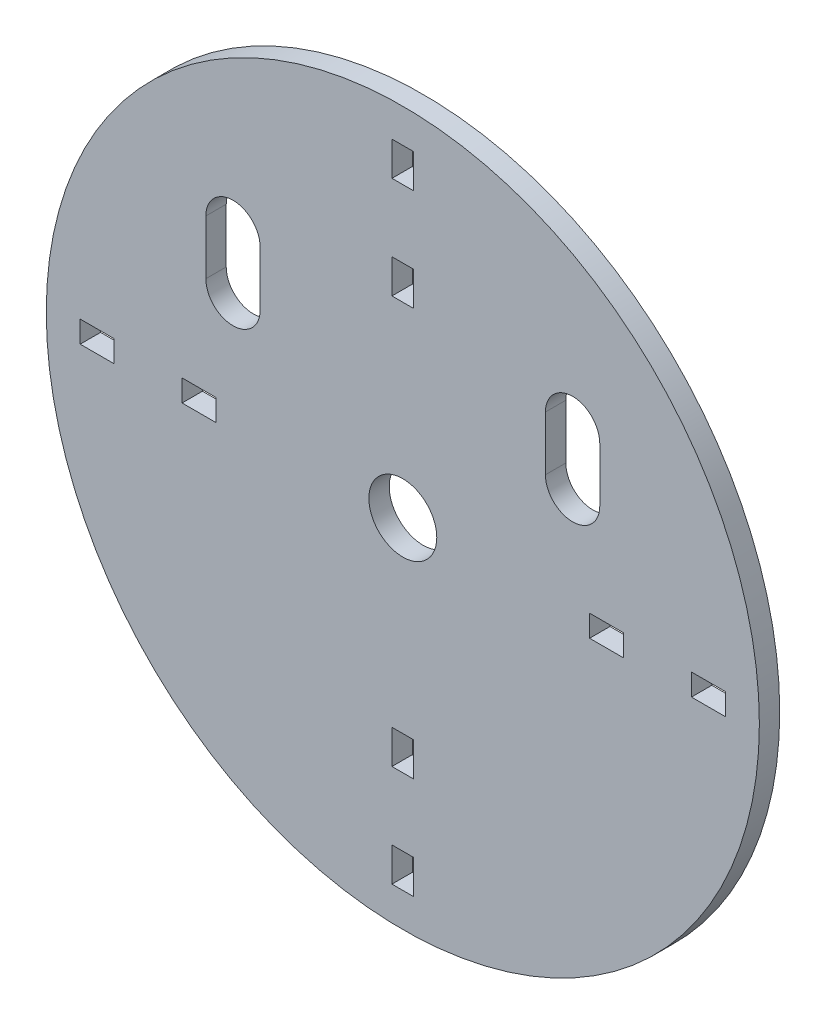
from build123d import *

# Parameters (mm, degrees)
SKETCH1_R               = 52.5
BOSS_EXTRUDE1_DEPTH     = 3
RIB_START               = -47.5
RIB_SLOT_OUTLINE_W      = 3.2
RIB_SLOT_OUTLINE_H      = 3
RIB_SLOT_DEPTH          = 5
RIB_START_2             = -32.5
RIB_SLOT_2_OUTLINE_W    = 3.2
RIB_SLOT_2_OUTLINE_H    = 3
RIB_SLOT_2_DEPTH        = 5
RIB_SLOT_PATTERN_COUNT  = 4
ANTENNA_CLEARANCE_REACH = 76.307
SKETCH3_R               = 5


# Read off the part's stored shape, not the designer's step: rib slot
with BuildPart() as part:
    # Sketch1 → Boss-Extrude1 (new body)
    with BuildSketch(Plane.XY):
        with Locations(Location((0, 0, 0), (0, 0, 180))):
            Circle(SKETCH1_R)
    extrude(amount=BOSS_EXTRUDE1_DEPTH)

    # rib slot outline → rib slot (cut)
    with BuildSketch(Plane(origin=(0, 0, 0), x_dir=(1, 0, 0), z_dir=(0, 1, 0)).offset(RIB_START)):
        with Locations((0, -1.5)):
            Rectangle(RIB_SLOT_OUTLINE_W, RIB_SLOT_OUTLINE_H)
    rib_slot = extrude(amount=RIB_SLOT_DEPTH, mode=Mode.SUBTRACT)

    # rib slot 2 outline → rib slot 2 (cut)
    with BuildSketch(Plane(origin=(0, 0, 0), x_dir=(1, 0, 0), z_dir=(0, 1, 0)).offset(RIB_START_2)):
        with Locations((0, -1.5)):
            Rectangle(RIB_SLOT_2_OUTLINE_W, RIB_SLOT_2_OUTLINE_H)
    rib_slot_2 = extrude(amount=RIB_SLOT_2_DEPTH, mode=Mode.SUBTRACT)

    # rib slot pattern: rib slot, rib slot 2 ×4 about axis
    rib_slot_pattern_axis = Axis((0, 0, 0), (0, 0, 1))
    add([rib_slot.rotate(rib_slot_pattern_axis, i * 360 / RIB_SLOT_PATTERN_COUNT) for i in range(1, RIB_SLOT_PATTERN_COUNT)], mode=Mode.SUBTRACT)
    add([rib_slot_2.rotate(rib_slot_pattern_axis, i * 360 / RIB_SLOT_PATTERN_COUNT) for i in range(1, RIB_SLOT_PATTERN_COUNT)], mode=Mode.SUBTRACT)

    # Sketch3 → antenna clearance (cut, up to next)
    with BuildSketch(Plane.XY.offset(3), mode=Mode.PRIVATE) as antenna_clearance_sk1:
        Circle(SKETCH3_R)
    antenna_clearance_tool1 = extrude(antenna_clearance_sk1.sketch, amount=-ANTENNA_CLEARANCE_REACH, mode=Mode.PRIVATE) & part.part
    # Sketch3 → antenna clearance (cut, up to next)
    with BuildSketch(Plane.XY.offset(3), mode=Mode.PRIVATE) as antenna_clearance_sk2:
        with BuildLine():
            Line((-21, 24), (-21, 16))
            ThreePointArc((-21, 16), (-25, 12), (-29, 16))
            Line((-29, 16), (-29, 24))
            ThreePointArc((-29, 24), (-25, 28), (-21, 24))
        make_face()
    antenna_clearance_tool2 = extrude(antenna_clearance_sk2.sketch, amount=-ANTENNA_CLEARANCE_REACH, mode=Mode.PRIVATE) & part.part
    # Sketch3 → antenna clearance (cut, up to next)
    with BuildSketch(Plane.XY.offset(3), mode=Mode.PRIVATE) as antenna_clearance_sk3:
        with BuildLine():
            Line((21, 24), (21, 16))
            ThreePointArc((21, 16), (25, 12), (29, 16))
            Line((29, 16), (29, 24))
            ThreePointArc((29, 24), (25, 28), (21, 24))
        make_face()
    antenna_clearance_tool3 = extrude(antenna_clearance_sk3.sketch, amount=-ANTENNA_CLEARANCE_REACH, mode=Mode.PRIVATE) & part.part
    add(antenna_clearance_tool1.solids().sort_by_distance((0, 0, 3))[0], mode=Mode.SUBTRACT)
    add(antenna_clearance_tool2.solids().sort_by_distance((-25, 20, 3))[0], mode=Mode.SUBTRACT)
    add(antenna_clearance_tool3.solids().sort_by_distance((25, 20, 3))[0], mode=Mode.SUBTRACT)


solid = part.part
